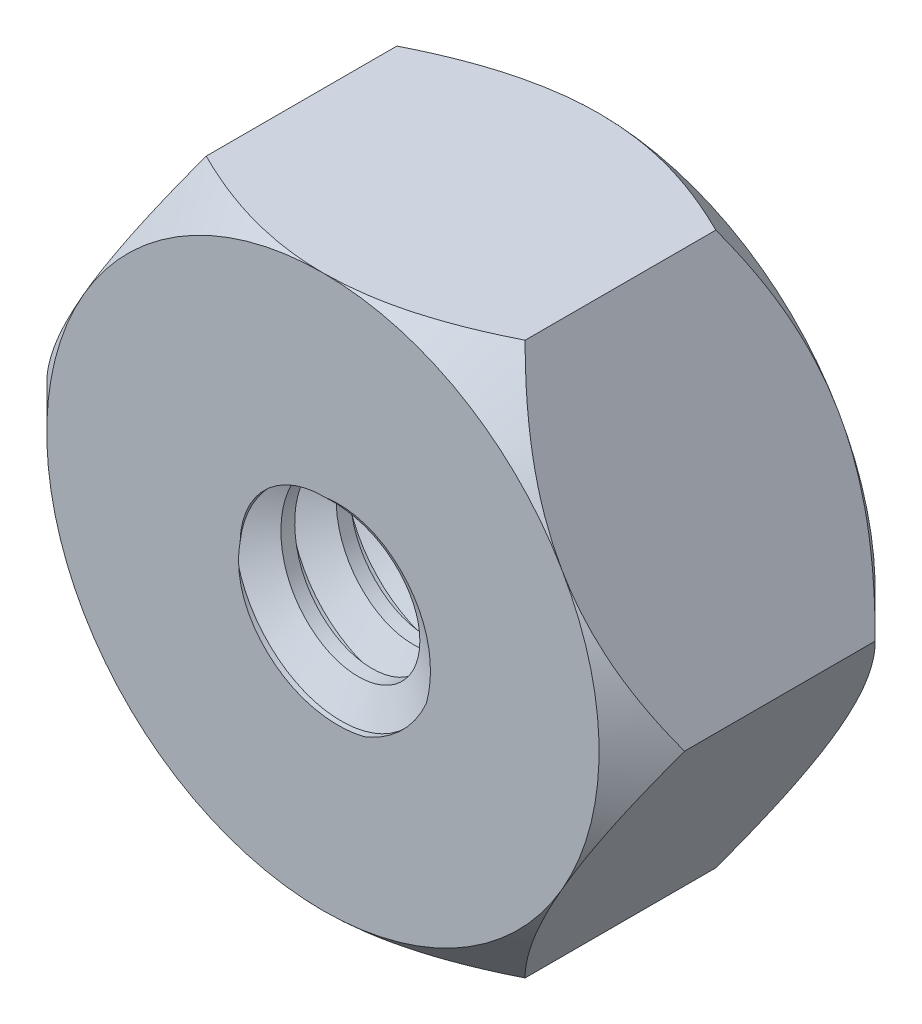
from build123d import *

# Parameters (mm, degrees)
SKETCH1_R               = 2
BOSS_EXTRUDE2_DEPTH     = 2.5
SKETCH4_OUTSIDE_W       = 91.762
SKETCH4_OUTSIDE_H       = 90.214
SKETCH4_OUTSIDE_R       = 5
CUT_EXTRUDE1_DEPTH      = 37.5
CUT_EXTRUDE1_DRAFT      = -45
MIRROR1_COPY_1_SKETCH_W = 91.762
MIRROR1_COPY_1_SKETCH_H = 90.214
MIRROR1_COPY_1_SKETCH_R = 5
MIRROR1_COPY_1_DEPTH    = 37.5
MIRROR1_COPY_1_DRAFT    = -45
SKETCH3_R               = 1.5
CUT_EXTRUDE4_DEPTH      = 10.128709292
THREAD2_PITCH           = 1


with BuildPart() as part:
    # Sketch1 → Boss-Extrude2 (new, symmetric)
    # profile 1 of 2: a face of its own
    with BuildSketch(Plane.XY):
        Polygon((-2.886751346, -5), (2.886751346, -5), (5.773502692, 0), (2.886751346, 5), (-2.886751346, 5), (-5.773502692, 0), align=None)
        Circle(SKETCH1_R, mode=Mode.SUBTRACT)
    # profile 2 of 2: a face of its own
    with BuildSketch(Plane.XY):
        Circle(SKETCH1_R)
    extrude(amount=BOSS_EXTRUDE2_DEPTH, both=True)


with BuildPart() as cut_extrude1_tool:
    # Sketch4 outside → Cut-Extrude1 (with draft: the straight prism first)
    with BuildSketch(Plane.XY.offset(2.5)):
        Rectangle(SKETCH4_OUTSIDE_W, SKETCH4_OUTSIDE_H)
        Circle(SKETCH4_OUTSIDE_R, mode=Mode.SUBTRACT)
    extrude(amount=-CUT_EXTRUDE1_DEPTH)
    # Cut-Extrude1: the draft: its side faces are tilted about the plane it starts from
    cut_extrude1_sides = [cut_extrude1_tool.faces().sort_by_distance(p)[0] for p in [
        (0, -45.107, -16.25),
        (45.881, 0, -16.25),
        (0, 45.107, -16.25),
        (-45.881, 0, -16.25),
        (-5, 0, -16.25),
    ]]
    draft(cut_extrude1_sides, Plane.XY.offset(2.5), CUT_EXTRUDE1_DRAFT)


with BuildPart() as part_1:
    add(part.part)

    # Cut-Extrude1: cut by cut_extrude1_tool
    add(cut_extrude1_tool.part, mode=Mode.SUBTRACT)


with BuildPart() as mirror1_copy_1_tool:
    # Mirror1 copy 1 sketch → Mirror1 copy 1 (with draft: the straight prism first)
    with BuildSketch(Plane(origin=(0, 0, -2.5), x_dir=(1, 0, 0), z_dir=(0, 0, -1))):
        Rectangle(MIRROR1_COPY_1_SKETCH_W, MIRROR1_COPY_1_SKETCH_H)
        Circle(MIRROR1_COPY_1_SKETCH_R, mode=Mode.SUBTRACT)
    extrude(amount=-MIRROR1_COPY_1_DEPTH)
    # Mirror1 copy 1: the draft: its side faces are tilted about the plane it starts from
    mirror1_copy_1_sides = [mirror1_copy_1_tool.faces().sort_by_distance(p)[0] for p in [
        (0, -45.107, 16.25),
        (45.881, 0, 16.25),
        (0, 45.107, 16.25),
        (-45.881, 0, 16.25),
        (-5, 0, 16.25),
    ]]
    draft(mirror1_copy_1_sides, Plane(origin=(0, 0, -2.5), x_dir=(1, 0, 0), z_dir=(0, 0, -1)), MIRROR1_COPY_1_DRAFT)


with BuildPart() as part_2:
    add(part_1.part)

    # Mirror1 copy 1: cut by mirror1_copy_1_tool
    add(mirror1_copy_1_tool.part, mode=Mode.SUBTRACT)

    # Sketch3 → Cut-Extrude4 (cut, through all)
    with BuildSketch(Plane.XY.offset(2.5)):
        Circle(SKETCH3_R)
    extrude(amount=-CUT_EXTRUDE4_DEPTH, mode=Mode.SUBTRACT)

    # Thread2: the profile of Thread Profile2 profile screwed along a right-hand helix of 6 turns, 8 arcs to a turn; built about Z, then put on its axis
    thread2_z = Axis((0, 0, 0), (0, 0, 1))
    thread2_corners = [(1.4997, 1e-09, -0.000173205), (2.041265875, 1e-09, 0.312499999), (2.041265875, 1e-09, 0.437499999), (1.4997, 1e-09, 0.750173202)]
    with BuildLine(mode=Mode.PRIVATE) as thread2_profile:
        Line(thread2_corners[0], thread2_corners[1])
        Line(thread2_corners[1], thread2_corners[2])
        Line(thread2_corners[2], thread2_corners[3])
        Line(thread2_corners[3], thread2_corners[0])
    thread2_cap = Face(thread2_profile.wire())
    thread2_turn_angles = [0, 22.5, 45, 67.5, 90, 112.5, 135, 157.5, 180, 202.5, 225, 247.5, 270, 292.5, 315, 337.5, 360]
    thread2_turn_weights = [1, 0.9238795325112867, 1, 0.9238795325112867, 1, 0.9238795325112867, 1, 0.9238795325112867, 1, 0.9238795325112867, 1, 0.9238795325112867, 1, 0.9238795325112867, 1, 0.9238795325112867, 1]
    thread2_turn_rails = [Edge.make_bspline([Vector(p[0], p[1], 0).rotate(thread2_z, thread2_turn_angles[k]) / thread2_turn_weights[k] + Vector(0, 0, p[2] + THREAD2_PITCH * thread2_turn_angles[k] / 360) for k in range(17)], [0, 0, 0, 1, 1, 2, 2, 3, 3, 4, 4, 5, 5, 6, 6, 7, 7, 8, 8, 8], 2, thread2_turn_weights) for p in thread2_corners]
    thread2_turn_sides = [Face.make_surface_from_curves(thread2_turn_rails[p[0]], thread2_turn_rails[p[1]]) for p in [(0, 1), (1, 2), (2, 3), (3, 0)]]
    thread2 = Plane(origin=(0, 0, 3.5), x_dir=(-0.999847695, 0.017452406, 0), z_dir=(0, 0, -1)) * Solid(Shell([*[p.moved(Location((0, 0, THREAD2_PITCH * i))) for i in range(6) for p in thread2_turn_sides], thread2_cap, thread2_cap.rotate(thread2_z, 2160).moved(Location((0, 0, THREAD2_PITCH * 2160 / 360)))]))
    add(thread2, mode=Mode.SUBTRACT)


solid = part_2.part
